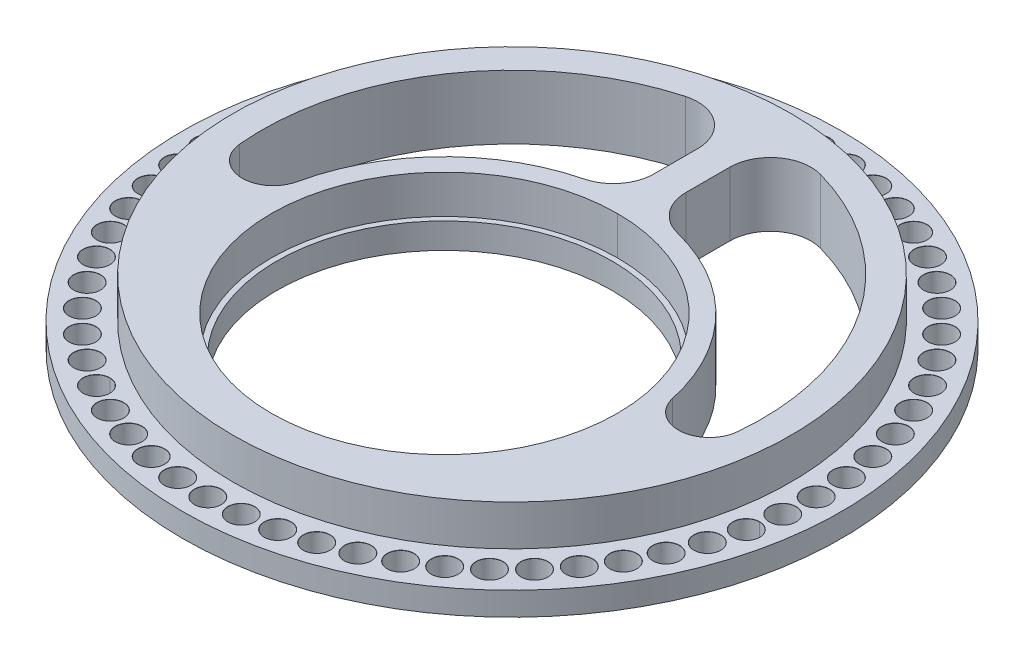
from build123d import *

# Parameters (mm, degrees)
SLOTTED_BODY_EXTRUDE_DEPTH      = 4.191
SLOTTED_BODY_EXTRUDE_DEPTH_BACK = 0.2032
SKETCH1_R                       = 61.9125
SKETCH1_R_2                     = 30.988
SKETCH5_R                       = 52.3875
BOSS_EXTRUDE3_DEPTH             = 7.62
SKETCH6_R                       = 32.512
CUT_EXTRUDE5_DEPTH              = 89.377917571
SKETCH8_R                       = 32.512
SKETCH8_R_2                     = 31.496
BOSS_EXTRUDE4_DEPTH             = 4.795000062
CIRPATTERN1_COUNT               = 60
CIRPATTERN1_ANGLE               = 354


with BuildPart() as part:
    # Sketch1 → Slotted-Body Extrude (new, two sides: drawn at the far end of the back side and taken through both)
    with BuildSketch(Plane(origin=(0, 0, 0), x_dir=(1, 0, 0), z_dir=(0, 1, 0)).offset(-SLOTTED_BODY_EXTRUDE_DEPTH_BACK)):
        Circle(SKETCH1_R)
        with Locations((0, -12.7)):
            Circle(SKETCH1_R_2, mode=Mode.SUBTRACT)
    extrude(amount=SLOTTED_BODY_EXTRUDE_DEPTH + SLOTTED_BODY_EXTRUDE_DEPTH_BACK)

    # Sketch5 → Boss-Extrude3 (add)
    with BuildSketch(Plane(origin=(0, 4.191, 0), x_dir=(1, 0, 0), z_dir=(0, 1, 0))):
        Circle(SKETCH5_R)
    extrude(amount=BOSS_EXTRUDE3_DEPTH)

    # Sketch6 → Cut-Extrude5 (cut, through all)
    with BuildSketch(Plane.XZ.offset(0.2032)):
        with Locations((0, 12.7)):
            Circle(SKETCH6_R)
        with BuildLine():
            Line((3.013951015, -37.906674687), (3.013951015, -29.674053734))
            ThreePointArc((3.013951015, -29.674053734), (4.62572071, -24.987309811), (8.779192117, -22.283230408))
            ThreePointArc((8.779192117, -22.283230408), (25.925135322, -12.375645206), (35.256203169, 5.09074497))
            ThreePointArc((35.256203169, 5.09074497), (41.313127715, 9.689980346), (46.782976949, 4.406037654))
            ThreePointArc((46.782976949, 4.406037654), (38.737451576, -26.59830719), (12.692135082, -45.243450433))
            ThreePointArc((12.692135082, -45.243450433), (6.03063496, -43.979061474), (3.013951015, -37.906674687))
        make_face()
        with BuildLine():
            Line((-3.013951015, -37.906674687), (-3.013951015, -29.674053734))
            ThreePointArc((-3.013951015, -29.674053734), (-4.62572071, -24.987309811), (-8.779192117, -22.283230408))
            ThreePointArc((-8.779192117, -22.283230408), (-25.925135322, -12.375645206), (-35.256203169, 5.09074497))
            ThreePointArc((-35.256203169, 5.09074497), (-41.313127715, 9.689980346), (-46.782976949, 4.406037654))
            ThreePointArc((-46.782976949, 4.406037654), (-38.737451576, -26.59830719), (-12.692135082, -45.243450433))
            ThreePointArc((-12.692135082, -45.243450433), (-6.03063496, -43.979061474), (-3.013951015, -37.906674687))
        make_face()
    extrude(amount=-CUT_EXTRUDE5_DEPTH, mode=Mode.SUBTRACT)

    # Sketch10 → Ø5.0mm Dowel Hole2 (revolve, cut)
    with BuildSketch(Plane(origin=(0, 4.191, -57.15), x_dir=(0, 0, 1), z_dir=(1, 0, 0))):
        Polygon((0, 0), (0, 4.3942), (2.5, 4.3942), (2.5, 0.025), (2.525, 0), align=None)
    f_5_0mm_dowel_hole2 = revolve(axis=Axis((0, 10.541, -57.15), (0, -1, 0)), mode=Mode.SUBTRACT)

    # CirPattern1: Ø5.0mm Dowel Hole2 ×60 about axis
    cirpattern1_axis = Axis((0, 11.811, 0), (0, -1, 0))
    for i in range(1, CIRPATTERN1_COUNT):
        add(f_5_0mm_dowel_hole2.rotate(cirpattern1_axis, i * CIRPATTERN1_ANGLE / (CIRPATTERN1_COUNT - 1)), mode=Mode.SUBTRACT)


with BuildPart() as body_2:
    # Sketch8 → Boss-Extrude4 (new body)
    with BuildSketch(Plane.XZ.offset(0.2032)):
        with Locations((0, 12.7)):
            Circle(SKETCH8_R)
        with Locations((0, 12.7)):
            Circle(SKETCH8_R_2, mode=Mode.SUBTRACT)
    extrude(amount=-BOSS_EXTRUDE4_DEPTH)


solid = Compound([part.part, body_2.part])
